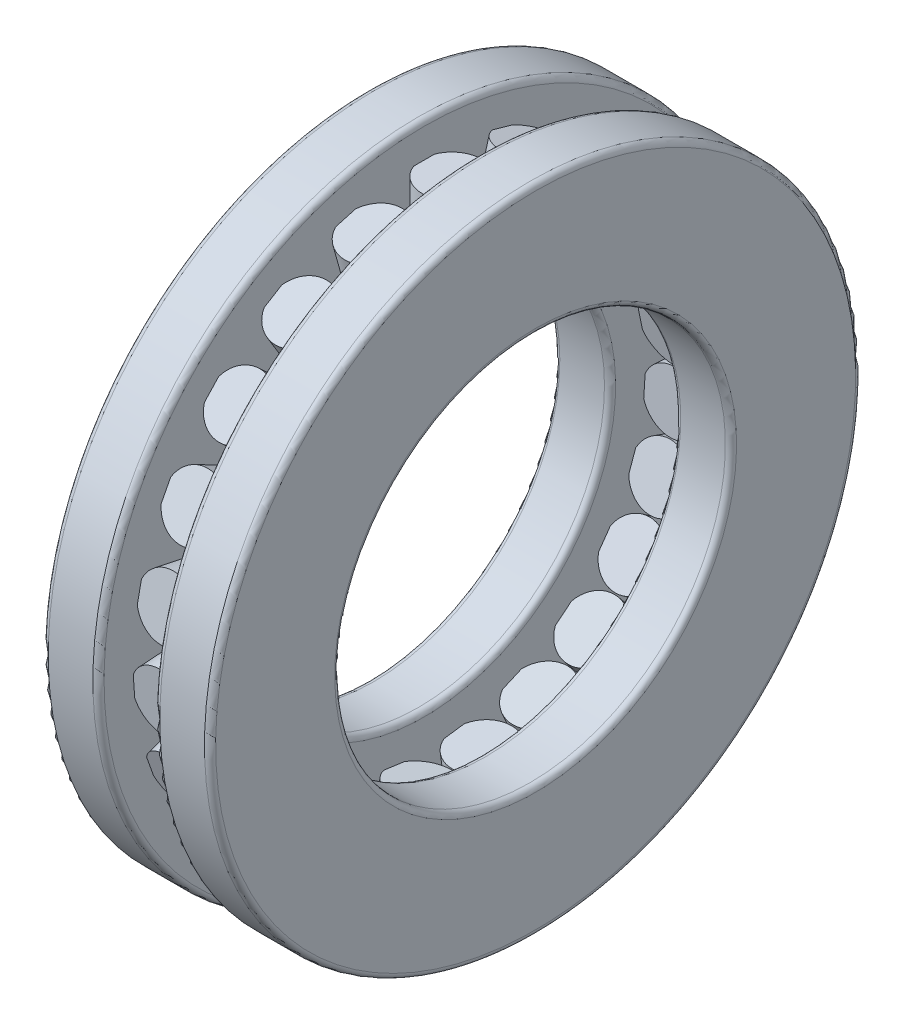
from build123d import *

# Parameters (mm, degrees)
SKETCH1_W               = 7.5
SKETCH1_H               = 3
SKETCH2_W               = 3.75
SKETCH2_H               = 1.6
SKETCH3_W               = 7
SKETCH3_H               = 3
CIRCULAR_PATTERN1_COUNT = 23
FILLET1_R               = 0.3


with BuildPart() as part:
    # Sketch1 → Revolve1 (revolve)
    with BuildSketch(Plane(origin=(-7.03002736, 10.46997264, 0), x_dir=(0, 1, 0), z_dir=(0, 0, 1))):
        with Locations((-24.21997264, -5.53002736)):
            Rectangle(SKETCH1_W, SKETCH1_H)
    revolve(axis=Axis((-25.185294118, 0, 0), (1, 0, 0)))

    # Sketch2 → Revolve2 (revolve)
    with BuildSketch(Plane(origin=(1.570880833, -3.029119167, 0), x_dir=(0, -1, 0), z_dir=(0, 0, 1))):
        with Locations((-16.779119167, 0.729119167)):
            Rectangle(SKETCH2_W, SKETCH2_H)
    revolve2 = revolve(axis=Axis((1.5, 16.546140247, 0), (0, -1, 0)))

    # Sketch3 → Revolve3 (revolve)
    with BuildSketch(Plane(origin=(-8.782998936, 8.717001064, 0), x_dir=(0, 1, 0), z_dir=(0, 0, 1))):
        with Locations((-22.717001064, -13.282998936)):
            Rectangle(SKETCH3_W, SKETCH3_H)
    revolve(axis=Axis((-15.612745098, 0, 0), (1, 0, 0)))

    # Circular-Pattern1: Revolve2 ×23 about axis
    circular_pattern1_axis = Axis((-25.185294118, 0, 0), (1, 0, 0))
    for i in range(1, CIRCULAR_PATTERN1_COUNT):
        add(revolve2.rotate(circular_pattern1_axis, i * 360 / CIRCULAR_PATTERN1_COUNT))

    # Fillet1
    fillet1_edges = [part.edges().sort_by_distance(p)[0] for p in [
        (0, 17.5, 0),
        (-3, 17.5, 0),
        (-3, 10, 0),
        (0, 10, 0),
        (3, 10.5, 0),
        (6, 10.5, 0),
        (6, 17.5, 0),
        (3, 17.5, 0),
    ]]
    fillet(fillet1_edges, radius=FILLET1_R)


solid = part.part
